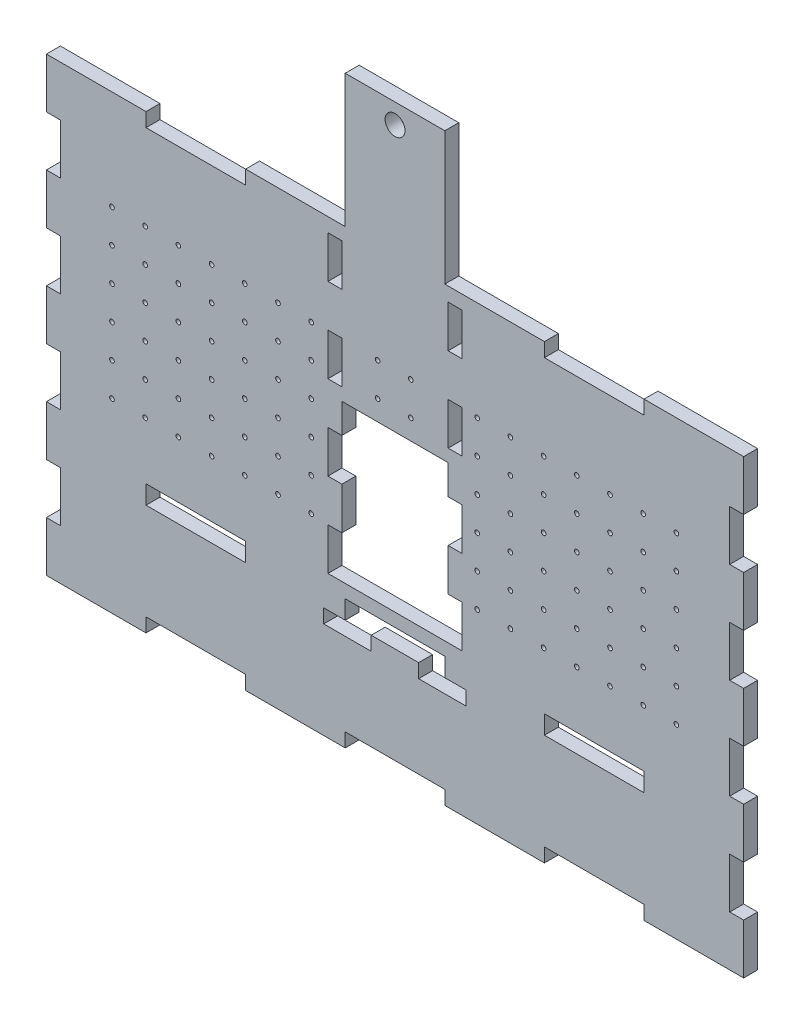
from build123d import *

# Parameters (mm, degrees)
SKETCH1_W           = 266.7
SKETCH1_H           = 172.72
BOSS_EXTRUDE1_DEPTH = 5.334
SKETCH2_W           = 38.1
SKETCH2_H           = 5.334
CUT_EXTRUDE1_DEPTH  = 165.701204222
SKETCH5_W           = 38.1
SKETCH5_H           = 7.112
CUT_EXTRUDE3_DEPTH  = 165.701204222
SKETCH8_W           = 18.149934459
SKETCH8_H           = 5.334
SKETCH8_W_2         = 18.14993446
CUT_EXTRUDE6_DEPTH  = 165.701204222
SKETCH9_W           = 5.334
SKETCH9_H           = 19.191111111
CUT_EXTRUDE7_DEPTH  = 165.701204222
SKETCH10_W          = 38.1
SKETCH10_H          = 5.334
BOSS_EXTRUDE2_DEPTH = 50.8
SKETCH11_W          = 6.604
SKETCH11_H          = 40.64
CUT_EXTRUDE8_DEPTH  = 197.710659379
SKETCH12_R          = 3.81
CUT_EXTRUDE9_DEPTH  = 197.710659379
SKETCH14_R          = 0.889
CUT_EXTRUDE11_DEPTH = 197.710659379
SKETCH15_W          = 6.604
SKETCH15_H          = 10.16
CUT_EXTRUDE12_DEPTH = 197.710659379
SKETCH16_W          = 40.64
SKETCH16_H          = 59.69
CUT_EXTRUDE13_DEPTH = 197.710659379
SKETCH17_W          = 5.334
SKETCH17_H          = 16.124650759
SKETCH17_H_2        = 16.124650758
CUT_EXTRUDE14_DEPTH = 197.710659379
SKETCH18_W          = 38.1
SKETCH18_H          = 56.134
BOSS_EXTRUDE3_DEPTH = 5.334
SKETCH19_W          = 34.756768033
SKETCH19_H          = 54.94363668
CUT_EXTRUDE15_DEPTH = 197.710659379
SKETCH20_R          = 3.81
CUT_EXTRUDE16_DEPTH = 197.710659379


with BuildPart() as part:
    # Sketch1 → Boss-Extrude1 (new body)
    with BuildSketch(Plane.XY):
        with Locations((5.474099752, 2.104142138)):
            Rectangle(SKETCH1_W, SKETCH1_H)
    extrude(amount=BOSS_EXTRUDE1_DEPTH)

    # Sketch2 → Cut-Extrude1 (cut, through all)
    with BuildSketch(Plane.XY.offset(5.334)):
        with Locations((-70.725900248, -81.588857862)):
            Rectangle(SKETCH2_W, SKETCH2_H)
        with Locations((5.474099752, -81.588857862)):
            Rectangle(SKETCH2_W, SKETCH2_H)
        with Locations((81.674099752, -81.588857862)):
            Rectangle(SKETCH2_W, SKETCH2_H)
        with Locations((81.674099752, 85.797142138)):
            Rectangle(SKETCH2_W, SKETCH2_H)
        with Locations((5.474099752, 85.797142138)):
            Rectangle(SKETCH2_W, SKETCH2_H)
        with Locations((-70.725900248, 85.797142138)):
            Rectangle(SKETCH2_W, SKETCH2_H)
    extrude(amount=-CUT_EXTRUDE1_DEPTH, mode=Mode.SUBTRACT)

    # Sketch5 → Cut-Extrude3 (cut, through all)
    with BuildSketch(Plane.XY.offset(5.334)):
        with Locations((-70.725900248, -38.378413173)):
            Rectangle(SKETCH5_W, SKETCH5_H)
        with Locations((5.474099752, -38.378413173)):
            Rectangle(SKETCH5_W, SKETCH5_H)
        with Locations((81.674099752, -38.378413173)):
            Rectangle(SKETCH5_W, SKETCH5_H)
    extrude(amount=-CUT_EXTRUDE3_DEPTH, mode=Mode.SUBTRACT)

    # Sketch8 → Cut-Extrude6 (cut, through all)
    with BuildSketch(Plane.XY.offset(5.334)):
        with Locations((-12.722736397, -44.601413173)):
            Rectangle(SKETCH8_W, SKETCH8_H)
        with Locations((23.577132522, -44.601413173)):
            Rectangle(SKETCH8_W_2, SKETCH8_H)
    extrude(amount=-CUT_EXTRUDE6_DEPTH, mode=Mode.SUBTRACT)

    # Sketch9 → Cut-Extrude7 (cut, through all)
    with BuildSketch(Plane.XY.offset(5.334)):
        with Locations((-125.208900248, -55.469191196)):
            Rectangle(SKETCH9_W, SKETCH9_H)
        with Locations((-125.208900248, -17.086968973)):
            Rectangle(SKETCH9_W, SKETCH9_H)
        with Locations((-125.208900248, 21.295253249)):
            Rectangle(SKETCH9_W, SKETCH9_H)
        with Locations((-125.208900248, 59.677475472)):
            Rectangle(SKETCH9_W, SKETCH9_H)
        with Locations((136.157099752, 59.677475472)):
            Rectangle(SKETCH9_W, SKETCH9_H)
        with Locations((136.157099752, 21.295253249)):
            Rectangle(SKETCH9_W, SKETCH9_H)
        with Locations((136.157099752, -17.086968973)):
            Rectangle(SKETCH9_W, SKETCH9_H)
        with Locations((136.157099752, -55.469191196)):
            Rectangle(SKETCH9_W, SKETCH9_H)
    extrude(amount=-CUT_EXTRUDE7_DEPTH, mode=Mode.SUBTRACT)

    # Sketch10 → Boss-Extrude2 (add)
    with BuildSketch(Plane(origin=(0, 88.464142138, 0), x_dir=(1, 0, 0), z_dir=(0, 1, 0))):
        with Locations((43.574099752, -2.667)):
            Rectangle(SKETCH10_W, SKETCH10_H)
    extrude(amount=BOSS_EXTRUDE2_DEPTH)

    # Sketch11 → Cut-Extrude8 (cut, through all)
    with BuildSketch(Plane(origin=(0, 0, 0), x_dir=(-1, 0, 0), z_dir=(0, 0, -1))):
        with Locations((-27.826099752, 108.784142138)):
            Rectangle(SKETCH11_W, SKETCH11_H)
    extrude(amount=-CUT_EXTRUDE8_DEPTH, mode=Mode.SUBTRACT)

    # Sketch12 → Cut-Extrude9 (cut, through all)
    with BuildSketch(Plane.XY.offset(5.334)):
        with Locations((43.574099752, 130.476471297)):
            Circle(SKETCH12_R)
    extrude(amount=-CUT_EXTRUDE9_DEPTH, mode=Mode.SUBTRACT)

    # Sketch14 → Cut-Extrude11 (cut, through all)
    with BuildSketch(Plane.XY.offset(5.334)):
        with Locations((-102.797588144, 50.364142138)):
            Circle(SKETCH14_R)
        with Locations((-90.097588144, 50.364142138)):
            Circle(SKETCH14_R)
        with Locations((-77.397588144, 50.364142138)):
            Circle(SKETCH14_R)
        with Locations((-64.697588144, 50.364142138)):
            Circle(SKETCH14_R)
        with Locations((-51.997588144, 50.364142138)):
            Circle(SKETCH14_R)
        with Locations((-39.297588144, 50.364142138)):
            Circle(SKETCH14_R)
        with Locations((-26.597588144, 50.364142138)):
            Circle(SKETCH14_R)
        with Locations((-1.197588144, 50.364142138)):
            Circle(SKETCH14_R)
        with Locations((11.502411856, 50.364142138)):
            Circle(SKETCH14_R)
        with Locations((36.902411856, 50.364142138)):
            Circle(SKETCH14_R)
        with Locations((49.602411856, 50.364142138)):
            Circle(SKETCH14_R)
        with Locations((62.302411856, 50.364142138)):
            Circle(SKETCH14_R)
        with Locations((75.002411856, 50.364142138)):
            Circle(SKETCH14_R)
        with Locations((87.702411856, 50.364142138)):
            Circle(SKETCH14_R)
        with Locations((100.402411856, 50.364142138)):
            Circle(SKETCH14_R)
        with Locations((113.102411856, 50.364142138)):
            Circle(SKETCH14_R)
        with Locations((-102.797588144, 37.664142138)):
            Circle(SKETCH14_R)
        with Locations((-90.097588144, 37.664142138)):
            Circle(SKETCH14_R)
        with Locations((-77.397588144, 37.664142138)):
            Circle(SKETCH14_R)
        with Locations((-64.697588144, 37.664142138)):
            Circle(SKETCH14_R)
        with Locations((-51.997588144, 37.664142138)):
            Circle(SKETCH14_R)
        with Locations((-39.297588144, 37.664142138)):
            Circle(SKETCH14_R)
        with Locations((-26.597588144, 37.664142138)):
            Circle(SKETCH14_R)
        with Locations((-1.197588144, 37.664142138)):
            Circle(SKETCH14_R)
        with Locations((11.502411856, 37.664142138)):
            Circle(SKETCH14_R)
        with Locations((36.902411856, 37.664142138)):
            Circle(SKETCH14_R)
        with Locations((49.602411856, 37.664142138)):
            Circle(SKETCH14_R)
        with Locations((62.302411856, 37.664142138)):
            Circle(SKETCH14_R)
        with Locations((75.002411856, 37.664142138)):
            Circle(SKETCH14_R)
        with Locations((87.702411856, 37.664142138)):
            Circle(SKETCH14_R)
        with Locations((100.402411856, 37.664142138)):
            Circle(SKETCH14_R)
        with Locations((113.102411856, 37.664142138)):
            Circle(SKETCH14_R)
        with Locations((-102.797588144, 24.964142138)):
            Circle(SKETCH14_R)
        with Locations((-90.097588144, 24.964142138)):
            Circle(SKETCH14_R)
        with Locations((-77.397588144, 24.964142138)):
            Circle(SKETCH14_R)
        with Locations((-64.697588144, 24.964142138)):
            Circle(SKETCH14_R)
        with Locations((-51.997588144, 24.964142138)):
            Circle(SKETCH14_R)
        with Locations((-39.297588144, 24.964142138)):
            Circle(SKETCH14_R)
        with Locations((-26.597588144, 24.964142138)):
            Circle(SKETCH14_R)
        with Locations((-1.197588144, 24.964142138)):
            Circle(SKETCH14_R)
        with Locations((11.502411856, 24.964142138)):
            Circle(SKETCH14_R)
        with Locations((36.902411856, 24.964142138)):
            Circle(SKETCH14_R)
        with Locations((49.602411856, 24.964142138)):
            Circle(SKETCH14_R)
        with Locations((62.302411856, 24.964142138)):
            Circle(SKETCH14_R)
        with Locations((75.002411856, 24.964142138)):
            Circle(SKETCH14_R)
        with Locations((87.702411856, 24.964142138)):
            Circle(SKETCH14_R)
        with Locations((100.402411856, 24.964142138)):
            Circle(SKETCH14_R)
        with Locations((113.102411856, 24.964142138)):
            Circle(SKETCH14_R)
        with Locations((-102.797588144, 12.264142138)):
            Circle(SKETCH14_R)
        with Locations((-90.097588144, 12.264142138)):
            Circle(SKETCH14_R)
        with Locations((-77.397588144, 12.264142138)):
            Circle(SKETCH14_R)
        with Locations((-64.697588144, 12.264142138)):
            Circle(SKETCH14_R)
        with Locations((-51.997588144, 12.264142138)):
            Circle(SKETCH14_R)
        with Locations((-39.297588144, 12.264142138)):
            Circle(SKETCH14_R)
        with Locations((-26.597588144, 12.264142138)):
            Circle(SKETCH14_R)
        with Locations((36.902411856, 12.264142138)):
            Circle(SKETCH14_R)
        with Locations((49.602411856, 12.264142138)):
            Circle(SKETCH14_R)
        with Locations((62.302411856, 12.264142138)):
            Circle(SKETCH14_R)
        with Locations((75.002411856, 12.264142138)):
            Circle(SKETCH14_R)
        with Locations((87.702411856, 12.264142138)):
            Circle(SKETCH14_R)
        with Locations((100.402411856, 12.264142138)):
            Circle(SKETCH14_R)
        with Locations((113.102411856, 12.264142138)):
            Circle(SKETCH14_R)
        with Locations((-102.797588144, -0.435857862)):
            Circle(SKETCH14_R)
        with Locations((-90.097588144, -0.435857862)):
            Circle(SKETCH14_R)
        with Locations((-77.397588144, -0.435857862)):
            Circle(SKETCH14_R)
        with Locations((-64.697588144, -0.435857862)):
            Circle(SKETCH14_R)
        with Locations((-51.997588144, -0.435857862)):
            Circle(SKETCH14_R)
        with Locations((-39.297588144, -0.435857862)):
            Circle(SKETCH14_R)
        with Locations((-26.597588144, -0.435857862)):
            Circle(SKETCH14_R)
        with Locations((-13.897588144, -0.435857862)):
            Circle(SKETCH14_R)
        with Locations((-1.197588144, -0.435857862)):
            Circle(SKETCH14_R)
        with Locations((11.502411856, -0.435857862)):
            Circle(SKETCH14_R)
        with Locations((24.202411856, -0.435857862)):
            Circle(SKETCH14_R)
        with Locations((36.902411856, -0.435857862)):
            Circle(SKETCH14_R)
        with Locations((49.602411856, -0.435857862)):
            Circle(SKETCH14_R)
        with Locations((62.302411856, -0.435857862)):
            Circle(SKETCH14_R)
        with Locations((75.002411856, -0.435857862)):
            Circle(SKETCH14_R)
        with Locations((87.702411856, -0.435857862)):
            Circle(SKETCH14_R)
        with Locations((100.402411856, -0.435857862)):
            Circle(SKETCH14_R)
        with Locations((113.102411856, -0.435857862)):
            Circle(SKETCH14_R)
        with Locations((-102.797588144, -13.135857862)):
            Circle(SKETCH14_R)
        with Locations((-90.097588144, -13.135857862)):
            Circle(SKETCH14_R)
        with Locations((-77.397588144, -13.135857862)):
            Circle(SKETCH14_R)
        with Locations((-64.697588144, -13.135857862)):
            Circle(SKETCH14_R)
        with Locations((-51.997588144, -13.135857862)):
            Circle(SKETCH14_R)
        with Locations((-39.297588144, -13.135857862)):
            Circle(SKETCH14_R)
        with Locations((-26.597588144, -13.135857862)):
            Circle(SKETCH14_R)
        with Locations((-13.897588144, -13.135857862)):
            Circle(SKETCH14_R)
        with Locations((-1.197588144, -13.135857862)):
            Circle(SKETCH14_R)
        with Locations((11.502411856, -13.135857862)):
            Circle(SKETCH14_R)
        with Locations((24.202411856, -13.135857862)):
            Circle(SKETCH14_R)
        with Locations((36.902411856, -13.135857862)):
            Circle(SKETCH14_R)
        with Locations((49.602411856, -13.135857862)):
            Circle(SKETCH14_R)
        with Locations((62.302411856, -13.135857862)):
            Circle(SKETCH14_R)
        with Locations((75.002411856, -13.135857862)):
            Circle(SKETCH14_R)
        with Locations((87.702411856, -13.135857862)):
            Circle(SKETCH14_R)
        with Locations((100.402411856, -13.135857862)):
            Circle(SKETCH14_R)
        with Locations((113.102411856, -13.135857862)):
            Circle(SKETCH14_R)
    extrude(amount=-CUT_EXTRUDE11_DEPTH, mode=Mode.SUBTRACT)

    # Sketch15 → Cut-Extrude12 (cut, through all)
    with BuildSketch(Plane.XY.offset(5.334)):
        with Locations((27.826099752, 134.184142138)):
            Rectangle(SKETCH15_W, SKETCH15_H)
    extrude(amount=-CUT_EXTRUDE12_DEPTH, mode=Mode.SUBTRACT)

    # Sketch16 → Cut-Extrude13 (cut, through all)
    with BuildSketch(Plane.XY.offset(5.334)):
        with Locations((5.474099752, 0.102586827)):
            Rectangle(SKETCH16_W, SKETCH16_H)
    extrude(amount=-CUT_EXTRUDE13_DEPTH, mode=Mode.SUBTRACT)

    # Sketch17 → Cut-Extrude14 (cut, through all)
    with BuildSketch(Plane.XY.offset(5.334)):
        with Locations((-17.512900248, -21.680087794)):
            Rectangle(SKETCH17_W, SKETCH17_H)
        with Locations((-17.512900248, 10.569213724)):
            Rectangle(SKETCH17_W, SKETCH17_H)
        with Locations((-17.512900248, 42.818515241)):
            Rectangle(SKETCH17_W, SKETCH17_H_2)
        with Locations((-17.512900248, 75.067816759)):
            Rectangle(SKETCH17_W, SKETCH17_H)
        with Locations((28.461099752, 75.067816759)):
            Rectangle(SKETCH17_W, SKETCH17_H)
        with Locations((28.461099752, 42.818515241)):
            Rectangle(SKETCH17_W, SKETCH17_H_2)
        with Locations((28.461099752, 10.569213724)):
            Rectangle(SKETCH17_W, SKETCH17_H)
        with Locations((28.461099752, -21.680087794)):
            Rectangle(SKETCH17_W, SKETCH17_H)
    extrude(amount=-CUT_EXTRUDE14_DEPTH, mode=Mode.SUBTRACT)

    # Sketch18 → Boss-Extrude3 (add)
    with BuildSketch(Plane.XY.offset(5.334)):
        with Locations((5.474099752, 111.197142138)):
            Rectangle(SKETCH18_W, SKETCH18_H)
    extrude(amount=-BOSS_EXTRUDE3_DEPTH)

    # Sketch19 → Cut-Extrude15 (cut, through all)
    with BuildSketch(Plane.XY.offset(5.334)):
        with Locations((48.506483768, 115.935960478)):
            Rectangle(SKETCH19_W, SKETCH19_H)
    extrude(amount=-CUT_EXTRUDE15_DEPTH, mode=Mode.SUBTRACT)

    # Sketch20 → Cut-Extrude16 (cut, through all)
    with BuildSketch(Plane.XY.offset(5.334)):
        with Locations((5.474099752, 131.644142138)):
            Circle(SKETCH20_R)
    extrude(amount=-CUT_EXTRUDE16_DEPTH, mode=Mode.SUBTRACT)


solid = part.part
